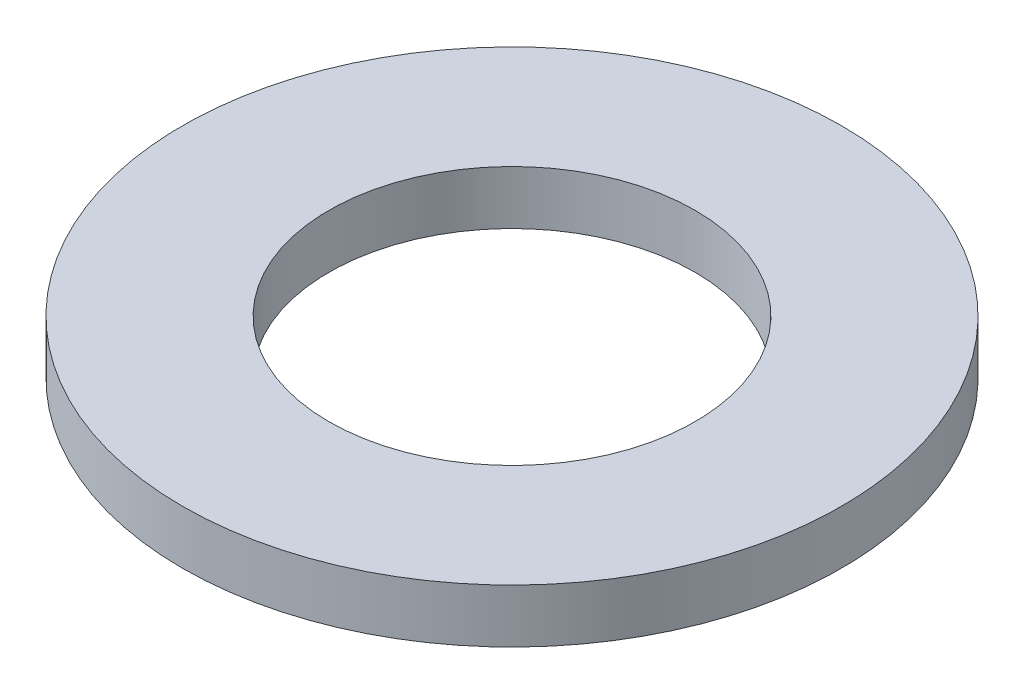
from build123d import *

# Parameters (mm, degrees)
SKETCH1_R           = 67.5
BOSS_EXTRUDE1_DEPTH = 11
SKETCH2_R           = 37.5
CUT_EXTRUDE1_DEPTH  = 97.091102606


with BuildPart() as part:
    # Sketch1 → Boss-Extrude1 (new body)
    with BuildSketch(Plane(origin=(0, 0, 0), x_dir=(1, 0, 0), z_dir=(0, 1, 0))):
        Circle(SKETCH1_R)
    extrude(amount=BOSS_EXTRUDE1_DEPTH)

    # Sketch2 → Cut-Extrude1 (cut, through all)
    with BuildSketch(Plane(origin=(0, 0, 0), x_dir=(1, 0, 0), z_dir=(0, 1, 0))):
        Circle(SKETCH2_R)
    extrude(amount=CUT_EXTRUDE1_DEPTH, mode=Mode.SUBTRACT)


solid = part.part
